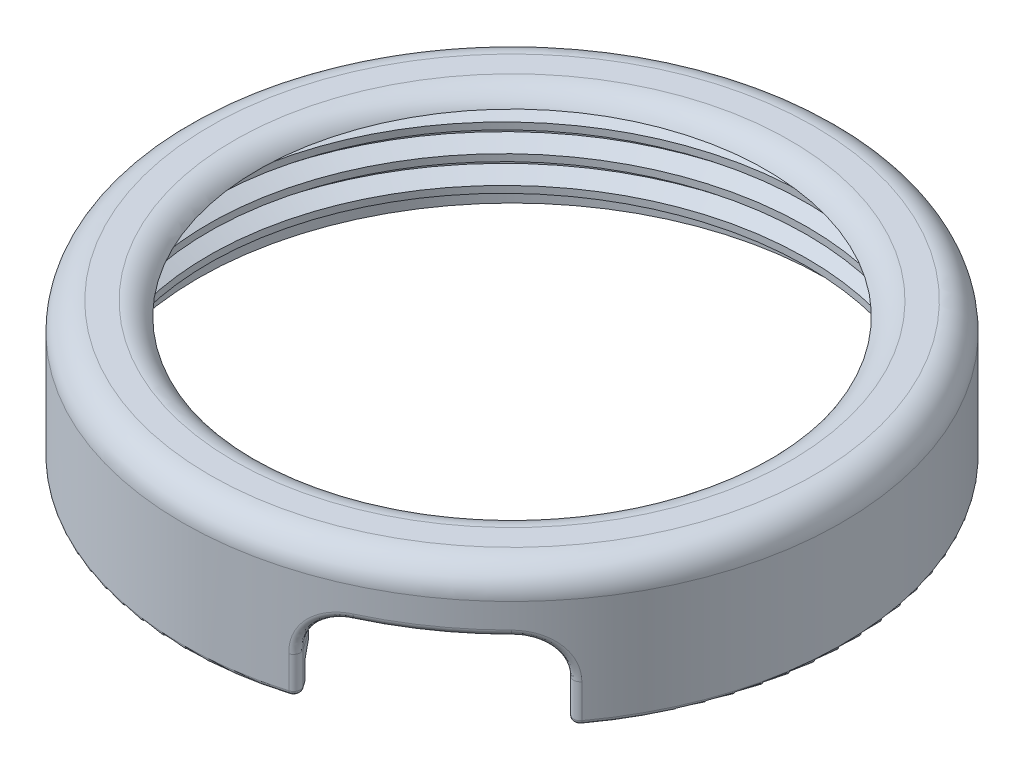
from build123d import *

# Parameters (mm, degrees)
SKETCH1_R           = 24
BOSS_EXTRUDE1_DEPTH = 10
CUT_EXTRUDE1_REACH  = 38.384
CUT_EXTRUDE1_START  = -1
SKETCH2_R           = 22.85
CUT_EXTRUDE2_REACH  = 37.384
SKETCH3_R           = 18.5
THREAD1_PITCH       = 2
SKETCH6_R           = 24
CUT_EXTRUDE3_DEPTH  = 2
FILLET1_R           = 2
FILLET2_R           = 2
CUT_EXTRUDE4_REACH  = 60.587
FILLET3_R           = 0.5
FILLET4_R           = 0.3


with BuildPart() as part:
    # Sketch1 → Boss-Extrude1 (new body)
    with BuildSketch(Plane(origin=(0, 0, 0), x_dir=(1, 0, 0), z_dir=(0, 1, 0))):
        with Locations(Location((0, 0, 0), (0, 0, 270))):
            Circle(SKETCH1_R)
    extrude(amount=BOSS_EXTRUDE1_DEPTH)

    # Sketch2 → Cut-Extrude1 (cut, up to next)
    with BuildSketch(Plane(origin=(0, 10, 0), x_dir=(1, 0, 0), z_dir=(0, 1, 0)).offset(CUT_EXTRUDE1_START), mode=Mode.PRIVATE) as cut_extrude1_sk1:
        with Locations(Location((0, 0, 0), (0, 0, 270))):
            Circle(SKETCH2_R)
    cut_extrude1_tool1 = extrude(cut_extrude1_sk1.sketch, amount=-CUT_EXTRUDE1_REACH, mode=Mode.PRIVATE) & part.part
    add(cut_extrude1_tool1.solids().sort_by_distance((0, 9, 0))[0], mode=Mode.SUBTRACT)

    # Sketch3 → Cut-Extrude2 (cut, up to next)
    with BuildSketch(Plane(origin=(0, 10, 0), x_dir=(1, 0, 0), z_dir=(0, 1, 0)), mode=Mode.PRIVATE) as cut_extrude2_sk1:
        with Locations(Location((0, 0, 0), (0, 0, 270))):
            Circle(SKETCH3_R)
    cut_extrude2_tool1 = extrude(cut_extrude2_sk1.sketch, amount=-CUT_EXTRUDE2_REACH, mode=Mode.PRIVATE) & part.part
    add(cut_extrude2_tool1.solids().sort_by_distance((0, 10, 0))[0], mode=Mode.SUBTRACT)

    # Thread1: the profile of Thread Profile1 profile screwed along a right-hand helix of 4.5 turns, 10 arcs to a turn; built about Z, then put on its axis
    thread1_z = Axis((0, 0, 0), (0, 0, 1))
    thread1_corners = [(22.8503, 0, -0.000173205), (22.8503, 0, 1.7501732), (21.76746825, 0, 1.124999997), (21.76746825, 0, 0.624999997)]
    with BuildLine(mode=Mode.PRIVATE) as thread1_profile:
        Line(thread1_corners[0], thread1_corners[1])
        Line(thread1_corners[1], thread1_corners[2])
        Line(thread1_corners[2], thread1_corners[3])
        Line(thread1_corners[3], thread1_corners[0])
    thread1_cap = Face(thread1_profile.wire())
    thread1_turn_angles = [0, 18, 36, 54, 72, 90, 108, 126, 144, 162, 180, 198, 216, 234, 252, 270, 288, 306, 324, 342, 360]
    thread1_turn_weights = [1, 0.9510565162951535, 1, 0.9510565162951535, 1, 0.9510565162951535, 1, 0.9510565162951535, 1, 0.9510565162951535, 1, 0.9510565162951535, 1, 0.9510565162951535, 1, 0.9510565162951535, 1, 0.9510565162951535, 1, 0.9510565162951535, 1]
    thread1_turn_rails = [Edge.make_bspline([Vector(p[0], p[1], 0).rotate(thread1_z, thread1_turn_angles[k]) / thread1_turn_weights[k] + Vector(0, 0, p[2] + THREAD1_PITCH * thread1_turn_angles[k] / 360) for k in range(21)], [0, 0, 0, 1, 1, 2, 2, 3, 3, 4, 4, 5, 5, 6, 6, 7, 7, 8, 8, 9, 9, 10, 10, 10], 2, thread1_turn_weights) for p in thread1_corners]
    thread1_turn_sides = [Face.make_surface_from_curves(thread1_turn_rails[p[0]], thread1_turn_rails[p[1]]) for p in [(0, 1), (1, 2), (2, 3), (3, 0)]]
    thread1_last_angles = [1440, 1458, 1476, 1494, 1512, 1530, 1548, 1566, 1584, 1602, 1620]
    thread1_last_weights = [1, 0.9510565162951535, 1, 0.9510565162951535, 1, 0.9510565162951535, 1, 0.9510565162951535, 1, 0.951056516295153, 1]
    thread1_last_rails = [Edge.make_bspline([Vector(p[0], p[1], 0).rotate(thread1_z, thread1_last_angles[k]) / thread1_last_weights[k] + Vector(0, 0, p[2] + THREAD1_PITCH * thread1_last_angles[k] / 360) for k in range(11)], [0, 0, 0, 1, 1, 2, 2, 3, 3, 4, 4, 5, 5, 5], 2, thread1_last_weights) for p in thread1_corners]
    thread1_last_sides = [Face.make_surface_from_curves(thread1_last_rails[p[0]], thread1_last_rails[p[1]]) for p in [(0, 1), (1, 2), (2, 3), (3, 0)]]
    thread1 = Plane(origin=(0, 0, 0), x_dir=(1, 0, 0), z_dir=(0, 1, 0)) * Solid(Shell([*[p.moved(Location((0, 0, THREAD1_PITCH * i))) for i in range(4) for p in thread1_turn_sides], *thread1_last_sides, thread1_cap, thread1_cap.rotate(thread1_z, 1620).moved(Location((0, 0, THREAD1_PITCH * 1620 / 360)))]))
    add(thread1)

    # Sketch6 → Cut-Extrude3 (cut)
    with BuildSketch(Plane(origin=(0, 10, 0), x_dir=(1, 0, 0), z_dir=(0, 1, 0))):
        with Locations(Location((0, 0, 0), (0, 0, 270))):
            Circle(SKETCH6_R)
    extrude(amount=CUT_EXTRUDE3_DEPTH, mode=Mode.SUBTRACT)

    # Fillet1
    fillet1_edges = [part.edges().sort_by_distance(p)[0] for p in [
        (0, 10, -24),
    ]]
    fillet(fillet1_edges, radius=FILLET1_R)

    # Fillet2
    # the kernel refuses this fillet: 2 mm, written as the material it takes off along each edge
    with BuildSketch(Plane(origin=(0, 10, 0), x_dir=(0, 0, 1), z_dir=(-1, 0, 0))) as fillet2_piece_1:
        with BuildLine():
            CenterArc((20.232050808, -2), FILLET2_R, 90, 60)
            Line((18.5, -1), (18.465358984, -0.98))
            ThreePointArc((18.465358984, -0.98), (18.46, -0.5), (18.46, 0))
            Line((18.46, 0), (18.5, 0.04))
            Line((18.5, 0.04), (20.232050808, 0.04))
            Line((20.232050808, 0.04), (20.232050808, 0))
        make_face()
    revolve(axis=Axis((0, 10, 0), (0, 1, 0)), mode=Mode.SUBTRACT)

    # Sketch9 → Cut-Extrude4 (cut, up to next)
    with BuildSketch(Plane(origin=(13.765834472, 0, 19.659649063), x_dir=(0, -1, 0), z_dir=(-0.5735764363510444, 0, -0.819152044288993)), mode=Mode.PRIVATE) as cut_extrude4_sk1:
        with BuildLine():
            Line((0, -7), (0, 7))
            Line((0, 7), (-2.64, 7))
            ThreePointArc((-2.64, 7), (-4.796704668, 6.176551502), (-5.7, 4.052051561))
            Line((-5.7, 4.052051561), (-5.7, -4.05))
            ThreePointArc((-5.7, -4.05), (-4.835965005, -6.135965005), (-2.75, -7))
            Line((-2.75, -7), (0, -7))
        make_face()
    cut_extrude4_tool1 = extrude(cut_extrude4_sk1.sketch, amount=CUT_EXTRUDE4_REACH, mode=Mode.PRIVATE) & part.part
    add(cut_extrude4_tool1.solids().sort_by_distance((13.765408, 2.742526, 19.659948))[0], mode=Mode.SUBTRACT)

    # Fillet3
    fillet3_edges = [part.edges().sort_by_distance(p)[0] for p in [
        (18.901360625, 1.375, 14.789812931),
        (7.433232004, 1.32, 22.81988304),
        (8.25240176, 4.807102739, 22.536589474),
        (13.764981957, 5.7, 19.660245973),
        (18.328219433, 4.84550935, 15.4943981),
    ]]
    fillet(fillet3_edges, radius=FILLET3_R)

    # Fillet4
    fillet4_edges = [part.edges().sort_by_distance(p)[0] for p in [
        (-10.823204028, 0, -21.420976975),
        (18.911735616, 0, 14.441522261),
        (7.102397375, 0, 22.710509918),
        (18.359180496, 0, 14.015499462),
        (6.891051876, 0, 22.04556957),
    ]]
    fillet(fillet4_edges, radius=FILLET4_R)


solid = part.part
